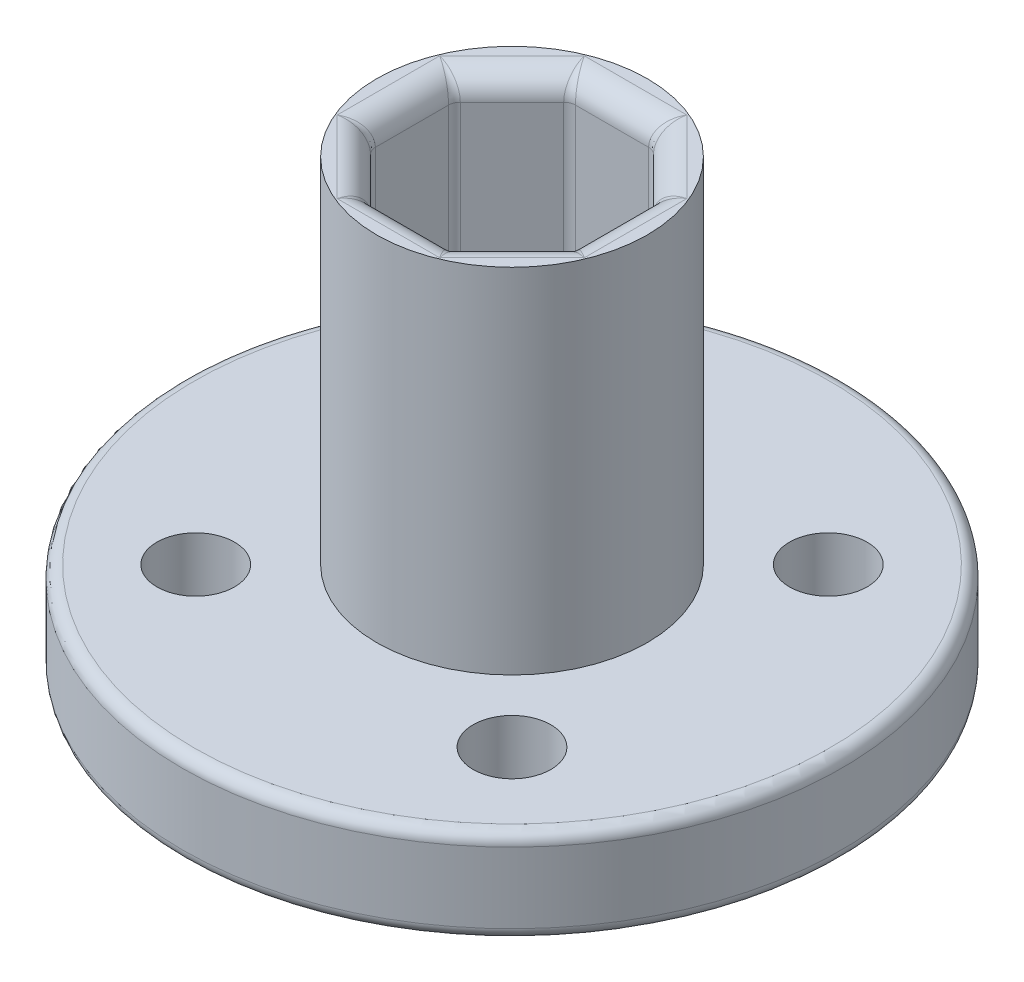
from build123d import *

# Parameters (mm, degrees)
SKETCH1_R           = 14
BOSS_EXTRUDE1_DEPTH = 4
SKETCH3_R           = 5.75
BOSS_EXTRUDE2_DEPTH = 15
CUT_EXTRUDE3_DEPTH  = 28.440845468
SKETCH5_R           = 1.65
CUT_EXTRUDE2_DEPTH  = 28.440845468
CHAMFER1_SIZE       = 1.6
FILLET1_R           = 1
FILLET2_R           = 0.5


with BuildPart() as part:
    # Sketch1 → Boss-Extrude1 (new body)
    with BuildSketch(Plane(origin=(0, 0, 0), x_dir=(1, 0, 0), z_dir=(0, 1, 0))):
        Circle(SKETCH1_R)
    extrude(amount=BOSS_EXTRUDE1_DEPTH)

    # Sketch3 → Boss-Extrude2 (add)
    with BuildSketch(Plane(origin=(0, 4, 0), x_dir=(1, 0, 0), z_dir=(0, 1, 0))):
        Circle(SKETCH3_R)
    extrude(amount=BOSS_EXTRUDE2_DEPTH)

    # Sketch6 → Cut-Extrude3 (cut, through all)
    with BuildSketch(Plane(origin=(0, 19, 0), x_dir=(1, 0, 0), z_dir=(0, 1, 0))):
        Polygon((1.76040764, 4.25), (-1.76040764, 4.25), (-4.25, 1.76040764), (-4.25, -1.76040764), (-1.76040764, -4.25), (1.76040764, -4.25), (4.25, -1.76040764), (4.25, 1.76040764), align=None)
    extrude(amount=-CUT_EXTRUDE3_DEPTH, mode=Mode.SUBTRACT)

    # Sketch5 → Cut-Extrude2 (cut, through all)
    with BuildSketch(Plane.XZ):
        with Locations((6.717514421, 6.717514421)):
            Circle(SKETCH5_R)
        with Locations((-6.717514421, 6.717514421)):
            Circle(SKETCH5_R)
        with Locations((-6.717514421, -6.717514421)):
            Circle(SKETCH5_R)
        with Locations((6.717514421, -6.717514421)):
            Circle(SKETCH5_R)
    extrude(amount=-CUT_EXTRUDE2_DEPTH, mode=Mode.SUBTRACT)

    # Chamfer1
    chamfer1_edges = [part.edges().sort_by_distance(p)[0] for p in [
        (5.067514421, 0, -6.717514421),
        (-8.367514421, 0, -6.717514421),
        (5.067514421, 0, 6.717514421),
        (-8.367514421, 0, 6.717514421),
    ]]
    chamfer(chamfer1_edges, length=CHAMFER1_SIZE)

    # Fillet1
    fillet1_edges = [part.edges().sort_by_distance(p)[0] for p in [
        (0, 19, 4.25),
        (-3.00520382, 19, 3.00520382),
        (-4.25, 19, 0),
        (-3.00520382, 19, -3.00520382),
        (0, 19, -4.25),
        (3.00520382, 19, -3.00520382),
        (4.25, 19, 0),
        (3.00520382, 19, 3.00520382),
    ]]
    fillet(fillet1_edges, radius=FILLET1_R)

    # Fillet2
    fillet2_edges = [part.edges().sort_by_distance(p)[0] for p in [
        (-14, 0, 0),
        (-14, 4, 0),
        (-1.76040764, 9, -4.25),
        (-4.25, 9, -1.76040764),
        (-4.25, 9, 1.76040764),
        (-1.76040764, 9, 4.25),
        (1.76040764, 9, 4.25),
        (4.25, 9, 1.76040764),
        (4.25, 9, -1.76040764),
        (1.76040764, 9, -4.25),
        (-1.887568488, 18.720931282, -4.556993444),
        (-4.556993444, 18.720931282, -1.887568488),
        (-4.556993444, 18.720931282, 1.887568488),
        (-1.887568488, 18.720931282, 4.556993444),
        (1.887568488, 18.720931282, 4.556993444),
        (4.556993444, 18.720931282, 1.887568488),
        (4.556993444, 18.720931282, -1.887568488),
        (1.887568488, 18.720931282, -4.556993444),
    ]]
    fillet(fillet2_edges, radius=FILLET2_R)


solid = part.part
